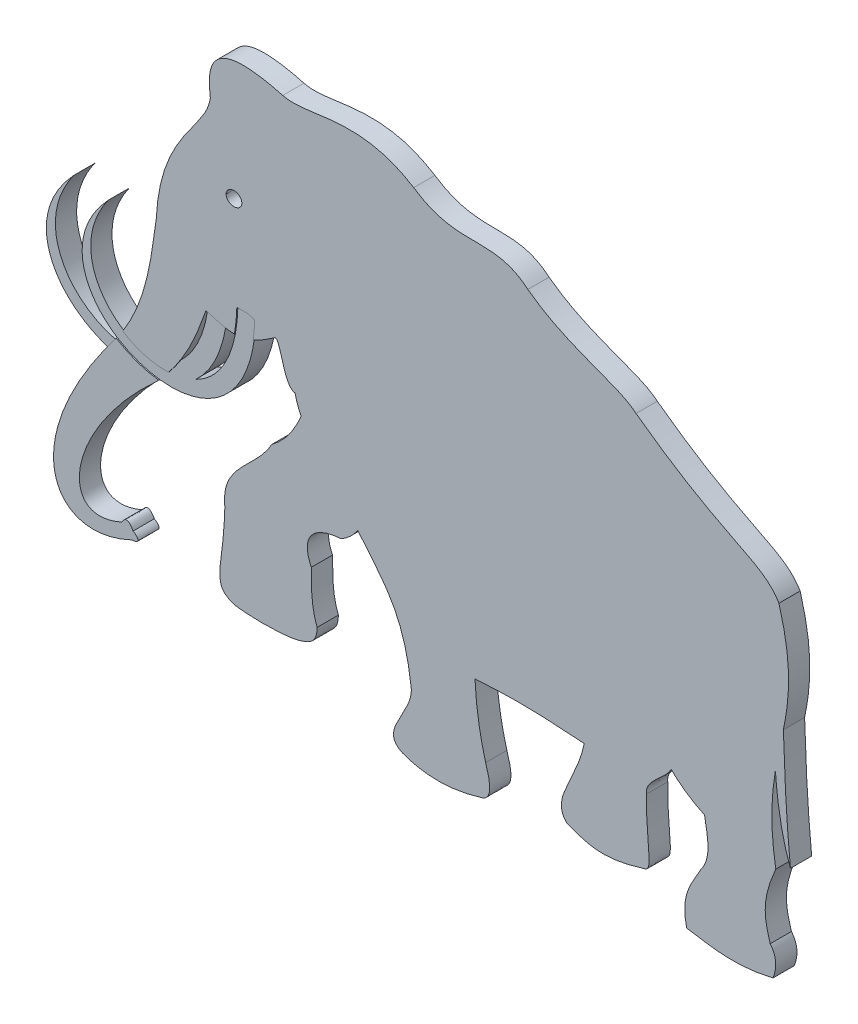
from build123d import *

# Parameters (mm, degrees)
BOSS_EXTRU_1_DEPTH   = 20
BOSS_EXTRU_1_2_DEPTH = 20
BOSS_EXTRU_2_DEPTH   = 19
BOSS_EXTRU_3_DEPTH   = 1


with BuildPart() as part:
    # Model → Boss.-Extru.1 (new body)
    with BuildSketch(Plane.XY):
        with BuildLine():
            add(Edge.make_bspline(
                [(240.824108954, -259.547723038), (238.204204507, -254.15924142), (236.226245447, -248.757625454), (235.124321832, -243.404953342)],
                knots=[14.842882057, 14.842882057, 14.842882057, 14.842882057, 15, 15, 15, 15], degree=3))
            add(Edge.make_bspline(
                [(212.849884711, -296.706092665), (226.482125241, -286.590228306), (234.666615965, -273.993562865), (240.824108954, -259.547723038)],
                knots=[8, 8, 8, 8, 8.693097804, 8.693097804, 8.693097804, 8.693097804], degree=3))
            add(Edge.make_bspline(
                [(168.776089138, -361.659233941), (169.318347168, -333.355018446), (200.344015842, -320.640549045), (212.849884711, -296.706092665)],
                knots=[7, 7, 7, 7, 8, 8, 8, 8], degree=3))
            add(Edge.make_bspline(
                [(164.602011447, -419.438652886), (166.148342556, -404.829725477), (169.702992079, -383.704399957), (168.776089138, -361.659233941)],
                knots=[6, 6, 6, 6, 7, 7, 7, 7], degree=3))
            add(Edge.make_bspline(
                [(178.519680447, -444.940972222), (161.394799805, -439.739222548), (164.853847928, -429.681610786), (164.602011447, -419.438652886)],
                knots=[5, 5, 5, 5, 6, 6, 6, 6], degree=3))
            add(Edge.make_bspline(
                [(245.324732802, -440.956719293), (232.798882378, -448.259632704), (189.653540039, -447.030767144), (178.519680447, -444.940972222)],
                knots=[4, 4, 4, 4, 5, 5, 5, 5], degree=3))
            add(Edge.make_bspline(
                [(255.994882541, -424.220100911), (255.639004178, -432.76187066), (253.459809028, -438.134152561), (245.324732802, -440.956719293)],
                knots=[3, 3, 3, 3, 4, 4, 4, 4], degree=3))
            add(Edge.make_bspline(
                [(250.428986274, -377.996221246), (250.771428765, -393.404755317), (249.774073622, -408.812944878), (255.994882541, -424.220100911)],
                knots=[2, 2, 2, 2, 3, 3, 3, 3], degree=3))
            add(Edge.make_bspline(
                [(278.727861871, -340.539765082), (254.529166667, -342.338104926), (239.263087294, -354.181309679), (250.428986274, -377.996221246)],
                knots=[1, 1, 1, 1, 2, 2, 2, 2], degree=3))
            add(Edge.make_bspline(
                [(294.130355637, -326.134912973), (290.862961165, -330.936379408), (286.670618079, -335.738072245), (278.727861871, -340.539765082)],
                knots=[0.452304144, 0.452304144, 0.452304144, 0.452304144, 1, 1, 1, 1], degree=3))
            add(Edge.make_bspline(
                [(302.271644423, -335.551266819), (299.944682712, -332.644411583), (297.184688826, -329.493367008), (294.130355637, -326.134912973)],
                knots=[14, 14, 14, 14, 14.131962188, 14.131962188, 14.131962188, 14.131962188], degree=3))
            add(Edge.make_bspline(
                [(344.407746039, -428.096522352), (337.837604438, -374.110842556), (319.875048828, -358.482166884), (302.271644423, -335.551266819)],
                knots=[13, 13, 13, 13, 14, 14, 14, 14], degree=3))
            add(Edge.make_bspline(
                [(336.388425022, -486.580118815), (312.213328722, -475.320513238), (347.784284125, -450.114127604), (344.407746039, -428.096522352)],
                knots=[12, 12, 12, 12, 13, 13, 13, 13], degree=3))
            add(Edge.make_bspline(
                [(411.090152995, -485.646842448), (383.798451063, -494.173453776), (358.733658854, -495.050230577), (336.388425022, -486.580118815)],
                knots=[11, 11, 11, 11, 12, 12, 12, 12], degree=3))
            add(Edge.make_bspline(
                [(414.696823459, -455.190475803), (416.918221029, -462.63394911), (423.659583876, -482.154204644), (411.090152995, -485.646842448)],
                knots=[10, 10, 10, 10, 11, 11, 11, 11], degree=3))
            add(Edge.make_bspline(
                [(404.622330729, -391.904760742), (405.802620443, -415.582557509), (409.009659831, -434.388644748), (414.696823459, -455.190475803)],
                knots=[9, 9, 9, 9, 10, 10, 10, 10], degree=3))
            add(Edge.make_bspline(
                [(404.920808374, -391.88580576), (404.821432445, -391.892101287), (404.721940008, -391.898419597), (404.622330729, -391.904760742)],
                knots=[8.997990579, 8.997990579, 8.997990579, 8.997990579, 9, 9, 9, 9], degree=3))
            add(Edge.make_bspline(
                [(507.597612847, -393.214241536), (474.893368986, -391.252420115), (454.276439178, -388.759095883), (404.920808374, -391.88580576)],
                knots=[8, 8, 8, 8, 8.997990579, 8.997990579, 8.997990579, 8.997990579], degree=3))
            add(Edge.make_bspline(
                [(507.597612847, -393.214241536), (507.595610308, -393.224018971), (500.511498278, -427.784094092), (475.310203676, -451.068937227), (491.228586155, -466.292640516)],
                knots=[7.999717115, 7.999717115, 7.999717115, 7.999717115, 8, 8.999717115, 8.999717115, 8.999717115, 8.999717115], degree=3))
            add(Edge.make_bspline(
                [(563.92871365, -467.088802083), (526.735807292, -478.725645616), (512.502395291, -474.827175564), (491.228586155, -466.292640516)],
                knots=[6, 6, 6, 6, 7, 7, 7, 7], degree=3))
            add(Edge.make_bspline(
                [(566.267588976, -405.003702799), (565.083854167, -441.930992296), (573.887106662, -466.411151801), (563.92871365, -467.088802083)],
                knots=[5, 5, 5, 5, 6, 6, 6, 6], degree=3))
            add(Edge.make_bspline(
                [(566.267588976, -405.003702799), (564.860605985, -392.903098533), (581.95374777, -386.16100415), (589.752895303, -373.246908906)],
                knots=[4.059052532, 4.059052532, 4.059052532, 4.059052532, 5.057833994, 5.057833994, 5.057833994, 5.057833994], degree=3))
            add(Edge.make_bspline(
                [(589.781399197, -373.1996148), (589.771911767, -373.215388703), (589.762410452, -373.231153398), (589.752895303, -373.246908906)],
                knots=[4, 4, 4, 4, 4.001218538, 4.001218538, 4.001218538, 4.001218538], degree=3))
            add(Edge.make_bspline(
                [(590.147702177, -373.643252693), (590.022257813, -373.494669274), (589.900117729, -373.346771159), (589.781399197, -373.1996148)],
                knots=[3.981818099, 3.981818099, 3.981818099, 3.981818099, 4, 4, 4, 4], degree=3))
            add(Edge.make_bspline(
                [(590.147702177, -373.643252693), (590.330343649, -373.825898022), (590.513707015, -374.008288758), (590.697794596, -374.190424262)],
                knots=[0.995463371, 0.995463371, 0.995463371, 0.995463371, 1, 1, 1, 1], degree=3))
            add(Edge.make_bspline(
                [(590.697794596, -374.190424262), (590.680483176, -374.199483771), (590.663176269, -374.20853943), (590.645873874, -374.217591243)],
                knots=[1, 1, 1, 1, 1.000340033, 1.000340033, 1.000340033, 1.000340033], degree=3))
            add(Edge.make_bspline(
                [(620.909214952, -394.819656033), (613.510621146, -391.762803417), (597.695326732, -382.138385801), (590.645873874, -374.217591243)],
                knots=[3, 3, 3, 3, 3.958523959, 3.958523959, 3.958523959, 3.958523959], degree=3))
            add(Edge.make_bspline(
                [(617.198502604, -441.495876736), (628.471888563, -426.468025716), (623.234998915, -409.847162543), (620.909214952, -394.819656033)],
                knots=[2, 2, 2, 2, 3, 3, 3, 3], degree=3))
            add(Edge.make_bspline(
                [(604.076822917, -495.596622721), (597.919403754, -468.516794162), (609.276505534, -456.483075629), (617.198502604, -441.495876736)],
                knots=[1, 1, 1, 1, 2, 2, 2, 2], degree=3))
            add(Edge.make_bspline(
                [(685.432408312, -495.596622721), (647.933921984, -504.513218859), (627.412177192, -498.845692274), (604.076822917, -495.596622721)],
                knots=[0, 0, 0, 0, 1, 1, 1, 1], degree=3))
            add(Edge.make_bspline(
                [(682.80793457, -468.933306207), (688.369007704, -475.808338759), (689.762548828, -484.473098416), (685.432408312, -495.596622721)],
                knots=[31, 31, 31, 31, 32, 32, 32, 32], degree=3))
            add(Edge.make_bspline(
                [(688.056882053, -405.429516602), (674.157299805, -436.548719618), (677.166246202, -450.402826606), (682.80793457, -468.933306207)],
                knots=[30, 30, 30, 30, 31, 31, 31, 31], degree=3))
            add(Edge.make_bspline(
                [(687.668621903, -325.026751395), (683.986683993, -346.803409135), (682.294272844, -371.625007208), (688.056882053, -405.429516602)],
                knots=[29.662537693, 29.662537693, 29.662537693, 29.662537693, 30, 30, 30, 30], degree=3))
            add(Edge.make_bspline(
                [(701.833474392, -397.92024197), (693.75053909, -376.8495722), (689.584538178, -351.588940347), (687.668621903, -325.026751395)],
                knots=[1, 1, 1, 1, 1.557812504, 1.557812504, 1.557812504, 1.557812504], degree=3))
            add(Edge.make_bspline(
                [(695.196392008, -288.169270309), (696.313287556, -325.066169204), (698.166373811, -361.752711585), (701.833474392, -397.92024197)],
                knots=[0.218070292, 0.218070292, 0.218070292, 0.218070292, 1, 1, 1, 1], degree=3))
            add(Edge.make_bspline(
                [(691.000371636, -187.039229329), (704.103723395, -231.810566073), (700.830133437, -260.444411565), (695.196392008, -288.169270309)],
                knots=[29, 29, 29, 29, 29.46191812, 29.46191812, 29.46191812, 29.46191812], degree=3))
            add(Edge.make_bspline(
                [(556.387744141, -99.525708008), (642.767312283, -162.770770942), (674.555208333, -159.52497423), (691.000371636, -187.039229329)],
                knots=[28, 28, 28, 28, 29, 29, 29, 29], degree=3))
            add(Edge.make_bspline(
                [(454.485609266, -49.274339464), (493.307356771, -78.330791558), (537.76528049, -83.472252062), (556.387744141, -99.525708008)],
                knots=[27, 27, 27, 27, 28, 28, 28, 28], degree=3))
            add(Edge.make_bspline(
                [(346.886147732, -19.970357259), (389.737451172, -49.233859592), (421.233203125, -21.029035102), (454.485609266, -49.274339464)],
                knots=[26, 26, 26, 26, 27, 27, 27, 27], degree=3))
            add(Edge.make_bspline(
                [(223.540532769, -6.4456014), (248.637364366, -12.988009983), (294.124854872, 13.079305013), (346.886147732, -19.970357259)],
                knots=[25, 25, 25, 25, 26, 26, 26, 26], degree=3))
            add(Edge.make_bspline(
                [(155.306627062, -42.511961534), (150.04941135, -7.926820204), (163.861488173, 9.595107693), (223.540532769, -6.4456014)],
                knots=[24, 24, 24, 24, 25, 25, 25, 25], degree=3))
            add(Edge.make_bspline(
                [(104.355559625, -166.705069987), (108.005638292, -90.859053548), (151.520122613, -71.665737576), (155.306627062, -42.511961534)],
                knots=[23, 23, 23, 23, 24, 24, 24, 24], degree=3))
            add(Edge.make_bspline(
                [(72.76572318, -274.106022433), (98.137525913, -234.303883345), (100.113452256, -192.596191092), (104.355559625, -166.705069987)],
                knots=[22.090887948, 22.090887948, 22.090887948, 22.090887948, 23, 23, 23, 23], degree=3))
            add(Edge.make_bspline(
                [(72.76572318, -274.106022433), (85.581481879, -282.299871017), (100.932176518, -286.735280271), (115.970124843, -286.121799981)],
                knots=[1.454856545, 1.454856545, 1.454856545, 1.454856545, 1.639902581, 1.639902581, 1.639902581, 1.639902581], degree=3))
            add(Edge.make_bspline(
                [(115.970124843, -286.121799981), (134.760504454, -262.408779251), (142.815112745, -241.591235452), (151.20971951, -218.199256727)],
                knots=[17.66269636, 17.66269636, 17.66269636, 17.66269636, 18.514713332, 18.514713332, 18.514713332, 18.514713332], degree=3))
            add(Edge.make_bspline(
                [(151.20971951, -218.199256727), (161.220365428, -220.639688781), (168.910069744, -223.911690107), (177.972991296, -223.912278823)],
                knots=[16.990856932, 16.990856932, 16.990856932, 16.990856932, 17.477080173, 17.477080173, 17.477080173, 17.477080173], degree=3))
            add(Edge.make_bspline(
                [(180.285980903, -201.050777181), (180.051137699, -209.345869842), (179.255378838, -216.955149141), (177.972991296, -223.912278823)],
                knots=[1, 1, 1, 1, 1.054880767, 1.054880767, 1.054880767, 1.054880767], degree=3))
            add(Edge.make_bspline(
                [(197.076859538, -203.235828993), (191.946251085, -200.100964355), (186.066851128, -200.829257541), (180.285980903, -201.050777181)],
                knots=[0, 0, 0, 0, 1, 1, 1, 1], degree=3))
            add(Edge.make_bspline(
                [(195.695711049, -219.87773035), (196.404644928, -214.632911597), (196.872410934, -209.088973998), (197.076859538, -203.235828993)],
                knots=[2.96588005, 2.96588005, 2.96588005, 2.96588005, 3, 3, 3, 3], degree=3))
            add(Edge.make_bspline(
                [(215.660738118, -208.115289985), (207.922058855, -213.643660396), (201.404059469, -217.412301708), (195.695711047, -219.877730349)],
                knots=[16, 16, 16, 16, 16.233859303, 16.233859303, 16.233859303, 16.233859303], degree=3))
            add(Edge.make_bspline(
                [(235.124321832, -243.404953342), (223.521756999, -242.388822428), (221.711876085, -203.793245443), (215.660738118, -208.115289985)],
                knots=[15, 15, 15, 15, 16, 16, 16, 16], degree=3))
        make_face()
        with BuildLine():
            add(Edge.make_bspline(
                [(185.014202203, -113.603746202), (185.014202203, -117.235221354), (181.689512804, -120.178538683), (173.490874566, -120.178538683), (170.167907715, -117.235221354), (170.167907715, -109.97227105), (173.490874566, -107.028953722), (181.689512804, -107.028953722), (185.014202203, -109.97227105), (185.014202203, -113.603746202)],
                knots=[0, 0, 0, 0, 0.999495883, 0.999495883, 1.999495883, 1.999495883, 2.999495883, 2.999495883, 3.998991766, 3.998991766, 3.998991766, 3.998991766], degree=3))
        make_face(mode=Mode.SUBTRACT)
    extrude(amount=BOSS_EXTRU_1_DEPTH)



with BuildPart() as body_2:
    # Model → Boss.-Extru.1 2 (new body)
    with BuildSketch(Plane.XY):
        with BuildLine():
            add(Edge.make_bspline(
                [(105.149654134, -298.768326823), (105.62800311, -298.247487428), (106.100805975, -297.728332755), (106.568164289, -297.210812646)],
                knots=[17.988363199, 17.988363199, 17.988363199, 17.988363199, 18.006196624, 18.006196624, 18.006196624, 18.006196624], degree=3))
            add(Edge.make_bspline(
                [(106.568164296, -297.210812674), (92.34348621, -295.503620152), (78.477115859, -290.480185319), (66.714860917, -282.935680109)],
                knots=[2.444905681, 2.444905681, 2.444905681, 2.444905681, 2.591197158, 2.591197158, 2.591197158, 2.591197158], degree=3))
            add(Edge.make_bspline(
                [(66.714860917, -282.935680109), (65.969758379, -283.948936745), (65.207939996, -284.960064876), (64.428969998, -285.968763563)],
                knots=[22.005750797, 22.005750797, 22.005750797, 22.005750797, 22.029117942, 22.029117942, 22.029117942, 22.029117942], degree=3))
            add(Edge.make_bspline(
                [(64.428969998, -285.968763563), (-33.892160373, -415.646291775), (11.064785428, -474.233585612), (81.258261447, -440.227048069)],
                knots=[21.976535594, 21.976535594, 21.976535594, 21.976535594, 22.976535594, 22.976535594, 22.976535594, 22.976535594], degree=3))
            add(Edge.make_bspline(
                [(82.536047363, -432.392900933), (85.816811795, -434.031043837), (91.645052083, -439.738189019), (81.258261447, -440.227048069)],
                knots=[20, 20, 20, 20, 21, 21, 21, 21], degree=3))
            add(Edge.make_bspline(
                [(72.070536296, -430.241094293), (76.063229709, -422.45035536), (80.715831163, -428.631545681), (82.536047363, -432.392900933)],
                knots=[19, 19, 19, 19, 20, 20, 20, 20], degree=3))
            add(Edge.make_bspline(
                [(105.149654134, -298.768326823), (14.881606717, -380.708889431), (13.205740017, -457.061162652), (72.070536296, -430.241094293)],
                knots=[18, 18, 18, 18, 19, 19, 19, 19], degree=3))
        make_face()
    extrude(amount=BOSS_EXTRU_1_2_DEPTH)


with BuildPart() as part_1:
    add(part.part)

    add(body_2.part)  # Boss.-Extru.2 merges body 2
    # Esquisse3 → Boss.-Extru.2 (add)
    with BuildSketch(Plane.XY):
        with BuildLine():
            add(Edge.make_bspline(
                [(107.804834384, -297.350767343), (149.810143286, -301.816874636), (194.491815064, -277.242889322), (197.076859538, -203.235828993)],
                knots=[2.568587963, 2.568587963, 2.568587963, 2.568587963, 3, 3, 3, 3], degree=3))
            add(Edge.make_bspline(
                [(197.076859538, -203.235828993), (191.946251085, -200.100964355), (186.066851128, -200.829257541), (180.285980903, -201.050777181)],
                knots=[0, 0, 0, 0, 1, 1, 1, 1], degree=3))
            add(Edge.make_bspline(
                [(180.285980903, -201.050777181), (179.047238347, -244.805436102), (162.202061604, -269.478614685), (140.652844574, -280.010820773)],
                knots=[1, 1, 1, 1, 1.289483112, 1.289483112, 1.289483112, 1.289483112], degree=3))
            add(Edge.make_bspline(
                [(140.652844574, -280.010820773), (157.762258363, -264.399417378), (169.780883153, -238.788270243), (171.113414171, -200.628925239)],
                knots=[2.787611819, 2.787611819, 2.787611819, 2.787611819, 3, 3, 3, 3], degree=3))
            add(Edge.make_bspline(
                [(171.113414171, -200.628925239), (165.740270996, -197.34574924), (159.582335069, -198.108837891), (153.527752007, -198.340176053)],
                knots=[0, 0, 0, 0, 1, 1, 1, 1], degree=3))
            add(Edge.make_bspline(
                [(153.527752007, -198.340176053), (152.027918487, -251.30956745), (128.690423532, -277.578390955), (101.148570726, -285.13738619)],
                knots=[1, 1, 1, 1, 1.33460399, 1.33460399, 1.33460399, 1.33460399], degree=3))
            add(Edge.make_bspline(
                [(101.148570726, -285.13738619), (57.147038746, -277.58191374), (18.550723231, -229.887315551), (58.16854248, -175.047540961)],
                knots=[1.454856545, 1.454856545, 1.454856545, 1.454856545, 2, 2, 2, 2], degree=3))
            add(Edge.make_bspline(
                [(58.16854248, -175.047540961), (14.007087397, -222.064035599), (35.450583356, -266.780360183), (73.39205588, -286.829510351)],
                knots=[2, 2, 2, 2, 2.444905681, 2.444905681, 2.444905681, 2.444905681], degree=3))
            add(Edge.make_bspline(
                [(73.39205588, -286.829510351), (26.194740186, -280.474142811), (-16.687758438, -229.681484312), (25.62909885, -171.105318197)],
                knots=[1.444042332, 1.444042332, 1.444042332, 1.444042332, 2, 2, 2, 2], degree=3))
            add(Edge.make_bspline(
                [(25.62909885, -171.105318197), (-43.78242896, -245.005463889), (41.553242378, -313.478517038), (107.804834384, -297.350767343)],
                knots=[2, 2, 2, 2, 2.667674932, 2.667674932, 2.667674932, 2.667674932], degree=3))
        make_face()
    extrude(amount=BOSS_EXTRU_2_DEPTH)

    # Esquisse6 → Boss.-Extru.3 (add)
    with BuildSketch(Plane.XY):
        with BuildLine():
            add(Edge.make_bspline(
                [(107.804834384, -297.350767343), (146.487985064, -301.463654639), (187.440897689, -280.948305728), (195.695711049, -219.87773035)],
                knots=[2.568587963, 2.568587963, 2.568587963, 2.568587963, 2.96588005, 2.96588005, 2.96588005, 2.96588005], degree=3))
            add(Edge.make_bspline(
                [(195.695711047, -219.877730349), (188.863114036, -222.828720569), (183.190491689, -223.912617745), (177.972991296, -223.912278823)],
                knots=[16.233859303, 16.233859303, 16.233859303, 16.233859303, 16.513776759, 16.513776759, 16.513776759, 16.513776759], degree=3))
            add(Edge.make_bspline(
                [(177.972991296, -223.912278823), (172.491086768, -253.652368658), (158.116719461, -271.475330636), (140.652844574, -280.010820773)],
                knots=[1.054880767, 1.054880767, 1.054880767, 1.054880767, 1.289483112, 1.289483112, 1.289483112, 1.289483112], degree=3))
            add(Edge.make_bspline(
                [(140.652844574, -280.010820773), (157.762258363, -264.399417378), (169.780883153, -238.788270243), (171.113414171, -200.628925239)],
                knots=[2.787611819, 2.787611819, 2.787611819, 2.787611819, 3, 3, 3, 3], degree=3))
            add(Edge.make_bspline(
                [(171.113414171, -200.628925239), (165.740270996, -197.34574924), (159.582335069, -198.108837891), (153.527752007, -198.340176053)],
                knots=[0, 0, 0, 0, 1, 1, 1, 1], degree=3))
            add(Edge.make_bspline(
                [(153.527752007, -198.340176053), (149.04533827, -356.644897461), (-50.486151801, -276.466156684), (25.62909885, -171.105318197)],
                knots=[1, 1, 1, 1, 2, 2, 2, 2], degree=3))
            add(Edge.make_bspline(
                [(25.62909885, -171.105318197), (-43.78242896, -245.005463889), (41.553242378, -313.478517038), (107.804834384, -297.350767343)],
                knots=[2, 2, 2, 2, 2.667674932, 2.667674932, 2.667674932, 2.667674932], degree=3))
        make_face()
        with BuildLine():
            add(Edge.make_bspline(
                [(58.16854248, -175.047540961), (16.671798353, -219.22705099), (33.10163742, -261.375601619), (66.714860917, -282.935680109)],
                knots=[2, 2, 2, 2, 2.418059984, 2.418059984, 2.418059984, 2.418059984], degree=3))
            add(Edge.make_bspline(
                [(66.714860917, -282.935680109), (68.867880521, -280.007812748), (70.881330071, -277.062173301), (72.76572318, -274.106022433)],
                knots=[22.023367145, 22.023367145, 22.023367145, 22.023367145, 22.090887948, 22.090887948, 22.090887948, 22.090887948], degree=3))
            add(Edge.make_bspline(
                [(72.76572318, -274.106022433), (43.616042068, -255.468961692), (27.580686548, -217.387860452), (58.16854248, -175.047540961)],
                knots=[1.579109356, 1.579109356, 1.579109356, 1.579109356, 2, 2, 2, 2], degree=3))
        make_face()
    extrude(amount=-BOSS_EXTRU_3_DEPTH)


solid = part_1.part
